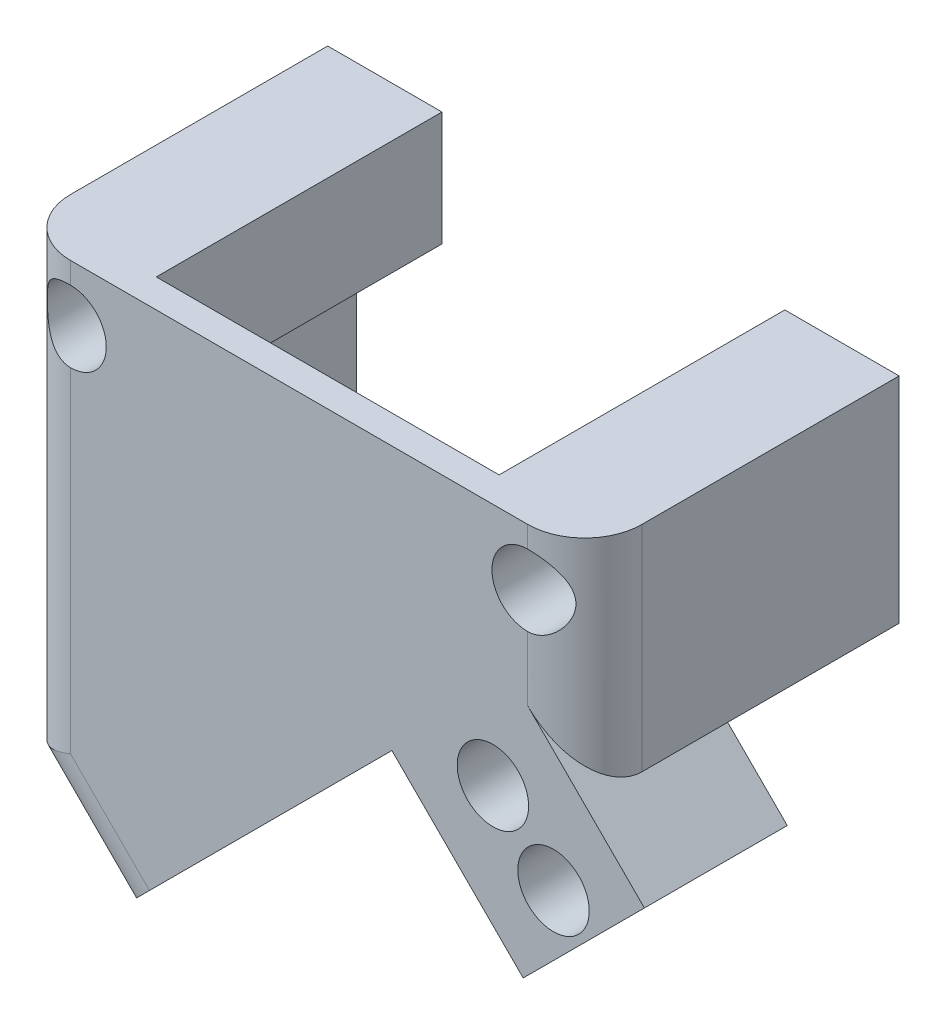
from build123d import *

# Parameters (mm, degrees)
BOSS_EXTRUDE1_DEPTH      = 11
BOSS_EXTRUDE2_START      = 11
BOSS_EXTRUDE2_DEPTH      = 1
SKETCH6_W                = 12
SKETCH6_H                = 1
UPPER_TUBE_OPENING_DEPTH = 10
LOWER_TUBE_OPENING_DEPTH = 1
SKETCH4_R                = 0.800000001
SKETCH4_R_2              = 0.800000002
SCREW_HOLES_DEPTH        = 29.262100116
SCREW_START              = 11
SKETCH5_R                = 1.25
SCREW_HEADS_DEPTH        = 3
FILLET1_R                = 2
CUT_EXTRUDE1_DEPTH       = 6


with BuildPart() as part:
    # Sketch2 → Boss-Extrude1 (new body)
    with BuildSketch(Plane.XY):
        Polygon((-6.378060684, -22.912224964), (3.521434253, -13.012730028), (8.11762833, -17.608924106), (12.360269017, -13.366283419), (10.274522062, -11.280536464), (10.274522062, -3.780536464), (-9.725477938, -3.780536464), (-9.725477938, -19.56480771), align=None)
        Polygon((-5.725477938, -7.780536464), (-5.725477938, -4.780536464), (6.274522063, -4.780536464), (6.274522063, -8.845428655), (-6.378060684, -21.498011402), (-8.725477938, -19.150594148), (-8.725477938, -7.780536464), align=None, mode=Mode.SUBTRACT)
    extrude(amount=BOSS_EXTRUDE1_DEPTH)

    # Sketch3 → Boss-Extrude2 (add)
    with BuildSketch(Plane.XY.offset(BOSS_EXTRUDE2_START)):
        Polygon((-6.378060684, -22.912224964), (3.521434253, -13.012730028), (8.11762833, -17.608924106), (12.360269017, -13.366283419), (10.274522062, -11.280536464), (10.274522062, -3.780536464), (-9.725477938, -3.780536464), (-9.725477938, -19.56480771), align=None)
    extrude(amount=-BOSS_EXTRUDE2_DEPTH)

    # Sketch6 → Upper Tube Opening (cut)
    with BuildSketch(Plane.XY):
        with Locations((0.274522062, -4.280536464)):
            Rectangle(SKETCH6_W, SKETCH6_H)
    extrude(amount=UPPER_TUBE_OPENING_DEPTH, mode=Mode.SUBTRACT)

    # Sketch7 → Lower Tube Opening (cut)
    with BuildSketch(Plane(origin=(8.26708214, -8.26708214, 0), x_dir=(0, 0, -1), z_dir=(0.7071067811865477, -0.7071067811865475, 0))):
        with BuildLine():
            Line((-8, -19.711359605), (0, -19.711359605))
            Line((0, -19.711359605), (0, -6.711359605))
            Line((0, -6.711359605), (-10, -6.711359605))
            Line((-10, -6.711359605), (-10, -17.711359605))
            ThreePointArc((-10, -17.711359605), (-9.414213562, -19.125573167), (-8, -19.711359605))
        make_face()
    extrude(amount=-LOWER_TUBE_OPENING_DEPTH, mode=Mode.SUBTRACT)

    # Sketch4 → Screw Holes (cut, through all)
    with BuildSketch(Plane.XY):
        with Locations((9.178288502, -14.426943591)):
            Circle(SKETCH4_R)
        with Locations((7.056968158, -12.305623247)):
            Circle(SKETCH4_R)
        with Locations((-7.725477938, -5.780536464)):
            Circle(SKETCH4_R_2)
        with Locations((8.274522062, -5.780536464)):
            Circle(SKETCH4_R_2)
    extrude(amount=SCREW_HOLES_DEPTH, mode=Mode.SUBTRACT)

    # Sketch5 → Screw Heads (cut)
    with BuildSketch(Plane.XY.offset(SCREW_START)):
        with Locations((-7.725477938, -5.780536464)):
            Circle(SKETCH5_R)
        with Locations((8.274522062, -5.780536464)):
            Circle(SKETCH5_R)
        with Locations((7.056968158, -12.305623247)):
            Circle(SKETCH5_R)
        with Locations((9.178288502, -14.426943591)):
            Circle(SKETCH5_R)
    extrude(amount=-SCREW_HEADS_DEPTH, mode=Mode.SUBTRACT)

    # Fillet1
    # the kernel refuses this fillet: 2 mm, written as the material it takes off along each edge
    with BuildSketch(Plane(origin=(10.274522062, -16.280536464, 11), x_dir=(-1, 0, 0), z_dir=(0, 1, 0))) as fillet1_piece_1_section:
        with BuildLine():
            CenterArc((FILLET1_R, -FILLET1_R), FILLET1_R, 90, 90)
            Line((0, -FILLET1_R), (0, 0))
            Line((0, 0), (FILLET1_R, 0))
        make_face()
    fillet1_piece_1 = extrude(amount=17.5, mode=Mode.PRIVATE)
    fillet1_piece_1 = split(fillet1_piece_1, bisect_by=Plane(origin=(6.821503017, -7.82751742, 10.5380934), z_dir=(0.707106781186547, 0.7071067811865481, 0)), keep=Keep.TOP, mode=Mode.PRIVATE)
    add(fillet1_piece_1, mode=Mode.SUBTRACT)
    with BuildSketch(Plane(origin=(-9.725477938, 1.219463536, 11), x_dir=(1, 0, 0), z_dir=(0, -1, 0))) as fillet1_piece_2:
        with BuildLine():
            CenterArc((FILLET1_R, -FILLET1_R), FILLET1_R, 90, 90)
            Line((0, -FILLET1_R), (0, 0))
            Line((0, 0), (FILLET1_R, 0))
        make_face()
    extrude(amount=25.784271246, mode=Mode.SUBTRACT)
    with BuildSketch(Plane(origin=(-13.261011844, -16.029273804, 11), x_dir=(0.7071067811865474, 0.7071067811865478, 0), z_dir=(0.7071067811865478, -0.7071067811865474, 0))) as fillet1_piece_3:
        with BuildLine():
            CenterArc((FILLET1_R, -FILLET1_R), FILLET1_R, 90, 90)
            Line((0, -FILLET1_R), (0, 0))
            Line((0, 0), (FILLET1_R, 0))
        make_face()
    extrude(amount=14.73396288, mode=Mode.SUBTRACT)

    # Sketch10 → Cut-Extrude1 (cut)
    with BuildSketch(Plane.XY):
        Polygon((12.360269017, -13.366283419), (8.11762833, -17.608924106), (2.814327472, -12.305623247), (7.056968158, -8.06298256), align=None)
    extrude(amount=CUT_EXTRUDE1_DEPTH, mode=Mode.SUBTRACT)


solid = part.part
